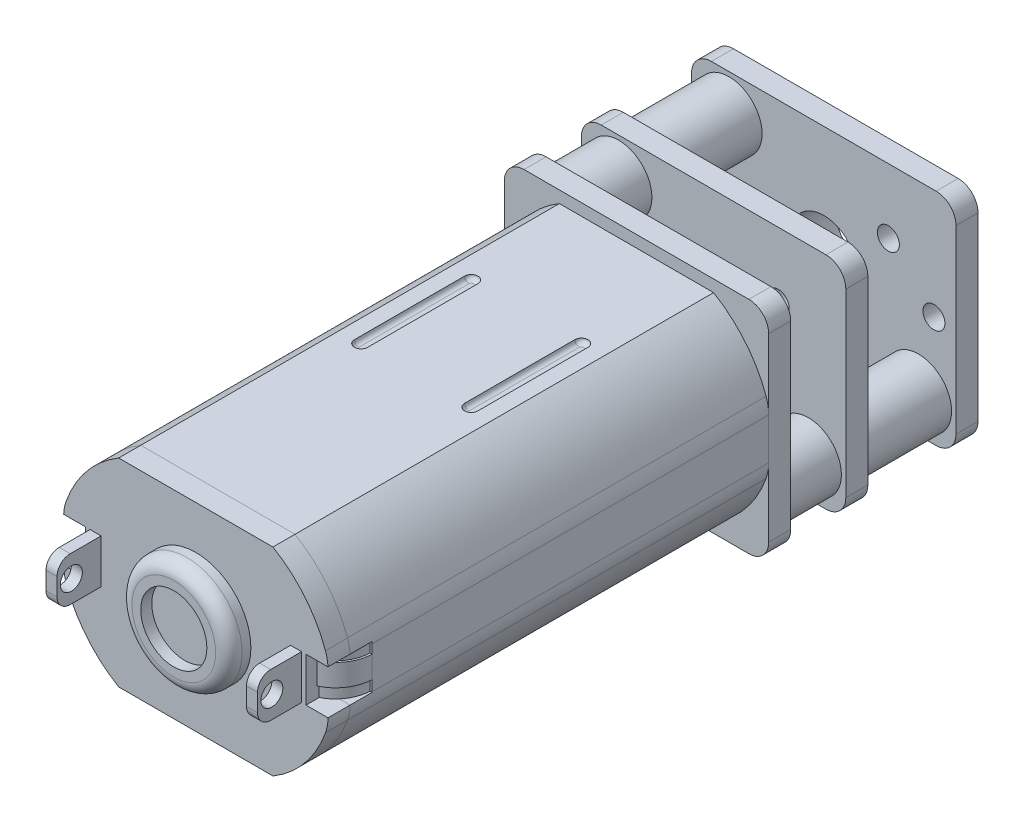
from build123d import *

# Parameters (mm, degrees)
BOSS_EXTRUDE1_DEPTH      = 20
FILLET2_R                = 2
BOSS_EXTRUDE2_DEPTH      = 1
SKETCH3_R                = 1
BOSS_EXTRUDE3_DEPTH      = 2
SKETCH4_R                = 1.5
BOSS_EXTRUDE4_DEPTH      = 2.5
BOSS_EXTRUDE5_DEPTH      = 1
SKETCH7_R                = 1.5
BOSS_EXTRUDE6_DEPTH      = 4
BOSS_EXTRUDE7_DEPTH      = 1
SKETCH10_R               = 2.5
BOSS_EXTRUDE8_DEPTH      = 1
SKETCH11_R               = 1.5
CUT_EXTRUDE1_DEPTH       = 0.5
FILLET3_R                = 0.6
SKETCH12_W               = 3.228098965
SKETCH12_H               = 2
CUT_EXTRUDE2_DEPTH       = 2
SPLIT1_SURFACE_1_BACK    = 35.267
SPLIT1_SURFACE_1_DEPTH   = 70.534
SPLIT1_SURFACE_2_BACK    = 35.267
SPLIT1_SURFACE_2_DEPTH   = 70.534
BOSS_EXTRUDE9_DEPTH      = 0.5
BOSS_EXTRUDE10_START     = -1
BOSS_EXTRUDE10_DEPTH     = 2
BOSS_EXTRUDE11_START     = -1
BOSS_EXTRUDE11_DEPTH     = 2
CUT_EXTRUDE3_DEPTH       = 0.2
FILLET4_R                = 0.2
FILLET4_OF_MIRROR2_R     = 0.2
SKETCH18_R               = 1.194438526
BOSS_EXTRUDE12_DEPTH     = 0.1
SKETCH19_R               = 0.5
CUT_EXTRUDE4_DEPTH       = 2
SKETCH20_R               = 1.5
CUT_EXTRUDE5_DEPTH       = 2
SKETCH21_R               = 2
SKETCH21_R_2             = 1.5
BOSS_EXTRUDE13_DEPTH     = 1
SKETCH23_W               = 0.5
SKETCH23_H               = 2
BOSS_EXTRUDE14_DEPTH     = 2
FILLET5_R                = 0.6
SKETCH24_R               = 0.5
CUT_EXTRUDE6_DEPTH       = 2
SKETCH25_R               = 0.5
CUT_EXTRUDE7_DEPTH       = 2
SKETCH29_R               = 0.5
CUT_EXTRUDE8_DEPTH       = 9
SKETCH30_R               = 0.75
CUT_EXTRUDE9_DEPTH       = 9.3
SKETCH31_R               = 0.5
CUT_EXTRUDE10_DEPTH      = 1
CHAMFER1_SIZE            = 0.2
CUT_EXTRUDE11_DEPTH      = 10
CUT_EXTRUDE11_DEPTH_BACK = 1
SKETCH32_R               = 0.5


# Read off the part's stored shape, not the designer's step: Boss-Extrude10, Boss-Extrude11
with BuildPart() as part:
    # Sketch1 → Boss-Extrude1 (new body)
    with BuildSketch(Plane.XY):
        with BuildLine():
            ThreePointArc((-3.5, -4.536728324), (-5.064185119, -3.153409185), (-6, -1.286728324))
            Line((-6, -1.286728324), (-6, 1.213271676))
            ThreePointArc((-6, 1.213271676), (-5.064185119, 3.079952537), (-3.5, 4.463271676))
            Line((-3.5, 4.463271676), (3.5, 4.463271676))
            ThreePointArc((3.5, 4.463271676), (5.064185119, 3.079952537), (6, 1.213271676))
            Line((6, 1.213271676), (6, -1.286728324))
            ThreePointArc((6, -1.286728324), (5.064185119, -3.153409185), (3.5, -4.536728324))
            Line((3.5, -4.536728324), (-3.5, -4.536728324))
        make_face()
    extrude(amount=BOSS_EXTRUDE1_DEPTH)

    # Fillet2
    fillet2_edges = [part.edges().sort_by_distance(p)[0] for p in [
        (-6, -1.286728324, 10),
        (-6, 1.213271676, 10),
        (6, 1.213271676, 10),
        (6, -1.286728324, 10),
    ]]
    fillet(fillet2_edges, radius=FILLET2_R)

    # Sketch10 → Boss-Extrude8 (add)
    with BuildSketch(Plane.XY.offset(20)):
        Circle(SKETCH10_R)
    extrude(amount=BOSS_EXTRUDE8_DEPTH)

    # Sketch11 → Cut-Extrude1 (cut)
    with BuildSketch(Plane.XY.offset(21)):
        Circle(SKETCH11_R)
    extrude(amount=-CUT_EXTRUDE1_DEPTH, mode=Mode.SUBTRACT)

    # Fillet3
    fillet3_edges = [part.edges().sort_by_distance(p)[0] for p in [
        (-2.5, 0, 21),
    ]]
    fillet(fillet3_edges, radius=FILLET3_R)

    # Sketch12 → Cut-Extrude2 (cut)
    with BuildSketch(Plane.XY.offset(20)):
        with Locations((6.614049483, 0)):
            Rectangle(SKETCH12_W, SKETCH12_H)
        with Locations((-6.614049483, 0)):
            Rectangle(SKETCH12_W, SKETCH12_H)
    extrude(amount=-CUT_EXTRUDE2_DEPTH, mode=Mode.SUBTRACT)


with BuildPart() as body_2:
    # Sketch2 → Boss-Extrude2 (new body)
    with BuildSketch(Plane(origin=(0, 0, 0), x_dir=(-1, 0, 0), z_dir=(0, 0, -1))):
        with BuildLine():
            Line((-5.1, -5), (5.1, -5))
            ThreePointArc((5.1, -5), (5.736396103, -4.736396103), (6, -4.1))
            Line((6, -4.1), (6, 4.1))
            ThreePointArc((6, 4.1), (5.736396103, 4.736396103), (5.1, 5))
            Line((5.1, 5), (-5.1, 5))
            ThreePointArc((-5.1, 5), (-5.736396103, 4.736396103), (-6, 4.1))
            Line((-6, 4.1), (-6, -4.1))
            ThreePointArc((-6, -4.1), (-5.736396103, -4.736396103), (-5.1, -5))
        make_face()
    extrude(amount=BOSS_EXTRUDE2_DEPTH)

    # Sketch3 → Boss-Extrude3 (add)
    with BuildSketch(Plane(origin=(0, 0, -1), x_dir=(-1, 0, 0), z_dir=(0, 0, -1))):
        with Locations(Location((0, 0, 0), (0, 0, 180))):
            Circle(SKETCH3_R)
    extrude(amount=BOSS_EXTRUDE3_DEPTH)

    # Sketch4 → Boss-Extrude4 (add)
    with BuildSketch(Plane(origin=(0, 0, -1), x_dir=(-1, 0, 0), z_dir=(0, 0, -1))):
        with Locations(Location((4.3, 3.3, 0), (0, 0, 180))):
            Circle(SKETCH4_R)
        with Locations(Location((-4.3, -3.3, 0), (0, 0, 180))):
            Circle(SKETCH4_R)
    extrude(amount=BOSS_EXTRUDE4_DEPTH)

    # Sketch5 → Boss-Extrude5 (add)
    with BuildSketch(Plane(origin=(0, 0, -3.5), x_dir=(-1, 0, 0), z_dir=(0, 0, -1))):
        with BuildLine():
            Line((5.1, 5), (-5.1, 5))
            ThreePointArc((-5.1, 5), (-5.736396103, 4.736396103), (-6, 4.1))
            Line((-6, 4.1), (-6, 1.107908183))
            Line((-6, 1.107908183), (-6, -4.1))
            ThreePointArc((-6, -4.1), (-5.736396103, -4.736396103), (-5.1, -5))
            Line((-5.1, -5), (1.1, -5))
            ThreePointArc((1.1, -5), (1.736396103, -4.736396103), (2, -4.1))
            Line((2, -4.1), (2, 0.207908183))
            ThreePointArc((2, 0.207908183), (2.263603897, 0.844304286), (2.9, 1.107908183))
            Line((2.9, 1.107908183), (5.1, 1.107908183))
            ThreePointArc((5.1, 1.107908183), (5.736396103, 1.37151208), (6, 2.007908183))
            Line((6, 2.007908183), (6, 4.1))
            ThreePointArc((6, 4.1), (5.736396103, 4.736396103), (5.1, 5))
        make_face()
    extrude(amount=BOSS_EXTRUDE5_DEPTH)

    # Sketch7 → Boss-Extrude6 (add)
    with BuildSketch(Plane(origin=(0, 0, -4.5), x_dir=(-1, 0, 0), z_dir=(0, 0, -1))):
        with Locations(Location((-4.3, -3.3, 0), (0, 0, 180))):
            Circle(SKETCH7_R)
        with Locations(Location((4.3, 3.3, 0), (0, 0, 180))):
            Circle(SKETCH7_R)
    extrude(amount=BOSS_EXTRUDE6_DEPTH)

    # Sketch8 → Boss-Extrude7 (add)
    with BuildSketch(Plane(origin=(0, 0, -8.5), x_dir=(-1, 0, 0), z_dir=(0, 0, -1))):
        with BuildLine():
            Line((5.1, 5), (-5.1, 5))
            ThreePointArc((-5.1, 5), (-5.736396103, 4.736396103), (-6, 4.1))
            Line((-6, 4.1), (-6, -4.1))
            ThreePointArc((-6, -4.1), (-5.736396103, -4.736396103), (-5.1, -5))
            Line((-5.1, -5), (5.1, -5))
            ThreePointArc((5.1, -5), (5.736396103, -4.736396103), (6, -4.1))
            Line((6, -4.1), (6, 4.1))
            ThreePointArc((6, 4.1), (5.736396103, 4.736396103), (5.1, 5))
        make_face()
    extrude(amount=BOSS_EXTRUDE7_DEPTH)

    # Sketch18 → Boss-Extrude12 (add)
    with BuildSketch(Plane(origin=(0, 0, -3), x_dir=(-1, 0, 0), z_dir=(0, 0, -1))):
        Circle(SKETCH18_R)
    extrude(amount=-BOSS_EXTRUDE12_DEPTH)

    # Sketch19 → Cut-Extrude4 (cut)
    with BuildSketch(Plane(origin=(0, 0, -9.5), x_dir=(-1, 0, 0), z_dir=(0, 0, -1))):
        with Locations((-5, 0)):
            Circle(SKETCH19_R)
        with Locations((5, 0)):
            Circle(SKETCH19_R)
    extrude(amount=-CUT_EXTRUDE4_DEPTH, mode=Mode.SUBTRACT)

    # Sketch20 → Cut-Extrude5 (cut)
    with BuildSketch(Plane(origin=(0, 0, -9.5), x_dir=(-1, 0, 0), z_dir=(0, 0, -1))):
        with Locations(Location((0, 0, 0), (0, 0, 180))):
            Circle(SKETCH20_R)
    extrude(amount=-CUT_EXTRUDE5_DEPTH, mode=Mode.SUBTRACT)

    # Sketch21 → Boss-Extrude13 (add)
    with BuildSketch(Plane(origin=(0, 0, -9.5), x_dir=(-1, 0, 0), z_dir=(0, 0, -1))):
        with Locations(Location((0, 0, 0), (0, 0, 180))):
            Circle(SKETCH21_R)
        with Locations(Location((0, 0, 0), (0, 0, 180))):
            Circle(SKETCH21_R_2, mode=Mode.SUBTRACT)
    extrude(amount=BOSS_EXTRUDE13_DEPTH)

    # Sketch29 → Cut-Extrude8 (cut)
    with BuildSketch(Plane(origin=(0, 0, -9.5), x_dir=(-1, 0, 0), z_dir=(0, 0, -1))):
        with Locations((3.22, -1.25)):
            Circle(SKETCH29_R)
    extrude(amount=-CUT_EXTRUDE8_DEPTH, mode=Mode.SUBTRACT)

    # Sketch30 → Cut-Extrude9 (cut)
    with BuildSketch(Plane(origin=(0, 0, -9.5), x_dir=(-1, 0, 0), z_dir=(0, 0, -1))):
        with Locations((-4.3, -3.3)):
            Circle(SKETCH30_R)
        with Locations((4.3, 3.3)):
            Circle(SKETCH30_R)
    extrude(amount=-CUT_EXTRUDE9_DEPTH, mode=Mode.SUBTRACT)

    # Sketch31 → Cut-Extrude10 (cut)
    with BuildSketch(Plane(origin=(0, 0, -4.5), x_dir=(-1, 0, 0), z_dir=(0, 0, -1))):
        Circle(SKETCH31_R)
    extrude(amount=-CUT_EXTRUDE10_DEPTH, mode=Mode.SUBTRACT)

    # Chamfer1
    chamfer1_edges = [body_2.edges().sort_by_distance(p)[0] for p in [
        (5.05, -3.3, -9.5),
        (-3.55, 3.3, -9.5),
    ]]
    chamfer(chamfer1_edges, length=CHAMFER1_SIZE)

    # Sketch32 → Cut-Extrude11 (cut, two sides: drawn at the far end of the back side and taken through both)
    with BuildSketch(Plane(origin=(0, 0, -4.5), x_dir=(-1, 0, 0), z_dir=(0, 0, -1)).offset(-CUT_EXTRUDE11_DEPTH_BACK)):
        with Locations(Location((-2.93, 2.06, 0), (0, 0, 180))):
            Circle(SKETCH32_R)
    extrude(amount=CUT_EXTRUDE11_DEPTH + CUT_EXTRUDE11_DEPTH_BACK, mode=Mode.SUBTRACT)


with BuildPart() as body_3:
    # Split1: the piece behind the surface
    add(part.part)
    # Split1 surface: a surface, the sketch's curves swept straight by 70.534 mm
    with BuildLine(Plane(origin=(0, 0, 0), x_dir=(0, 0, -1), z_dir=(1, 0, 0)).offset(-SPLIT1_SURFACE_1_BACK), mode=Mode.PRIVATE) as split1_surface_1_path:
        Line((-19, 9.247780944), (-19, -9.247780944))
    split1_surface_1 = Shell.extrude(split1_surface_1_path.wire(), (1 * SPLIT1_SURFACE_1_DEPTH, 0 * SPLIT1_SURFACE_1_DEPTH, 0 * SPLIT1_SURFACE_1_DEPTH))
    split(bisect_by=split1_surface_1, keep=Keep.BOTTOM)

    # Boss-Extrude10 outline → Boss-Extrude10 (add)
    with BuildSketch(Plane(origin=(0, 0, 0), x_dir=(1, 0, 0), z_dir=(0, 1, 0)).offset(BOSS_EXTRUDE10_START)):
        with BuildLine():
            ThreePointArc((-5.909884441, -18), (-5.645311676, -18.823724433), (-5, -19.4))
            Line((-5, -19.4), (-5, -18))
            Line((-5, -18), (-5.909884441, -18))
        make_face()
    extrude(amount=BOSS_EXTRUDE10_DEPTH)

    # Boss-Extrude11 outline → Boss-Extrude11 (add)
    with BuildSketch(Plane(origin=(0, 0, 0), x_dir=(1, 0, 0), z_dir=(0, 1, 0)).offset(BOSS_EXTRUDE11_START)):
        with BuildLine():
            Line((5.909884441, -18), (5, -18))
            Line((5, -18), (5, -19.4))
            ThreePointArc((5, -19.4), (5.645311676, -18.823724433), (5.909884441, -18))
        make_face()
    extrude(amount=BOSS_EXTRUDE11_DEPTH)

    # Sketch23 → Boss-Extrude14 (add)
    with BuildSketch(Plane.XY.offset(20)):
        with Locations((-4.55, 0)):
            Rectangle(SKETCH23_W, SKETCH23_H)
        with Locations((4.55, 0)):
            Rectangle(SKETCH23_W, SKETCH23_H)
    extrude(amount=BOSS_EXTRUDE14_DEPTH)

    # Fillet5
    fillet5_edges = [body_3.edges().sort_by_distance(p)[0] for p in [
        (-4.55, 1, 22),
        (-4.55, -1, 22),
        (4.55, 1, 22),
        (4.55, -1, 22),
    ]]
    fillet(fillet5_edges, radius=FILLET5_R)

    # Sketch24 → Cut-Extrude6 (cut)
    with BuildSketch(Plane.ZY.offset(4.8)):
        with Locations((21.35, 0)):
            Circle(SKETCH24_R)
    extrude(amount=-CUT_EXTRUDE6_DEPTH, mode=Mode.SUBTRACT)

    # Sketch25 → Cut-Extrude7 (cut)
    with BuildSketch(Plane(origin=(4.8, 0, 0), x_dir=(0, 0, -1), z_dir=(1, 0, 0))):
        with Locations(Location((-21.35, 0, 0), (0, 0, 180))):
            Circle(SKETCH25_R)
    extrude(amount=-CUT_EXTRUDE7_DEPTH, mode=Mode.SUBTRACT)


with BuildPart() as part_1:
    add(part.part)

    # Split1: split by a surface, the side it looks to stays
    # Split1 surface: a surface, the sketch's curves swept straight by 70.534 mm
    with BuildLine(Plane(origin=(0, 0, 0), x_dir=(0, 0, -1), z_dir=(1, 0, 0)).offset(-SPLIT1_SURFACE_2_BACK), mode=Mode.PRIVATE) as split1_surface_2_path:
        Line((-19, 9.247780944), (-19, -9.247780944))
    split1_surface_2 = Shell.extrude(split1_surface_2_path.wire(), (1 * SPLIT1_SURFACE_2_DEPTH, 0 * SPLIT1_SURFACE_2_DEPTH, 0 * SPLIT1_SURFACE_2_DEPTH))
    split(bisect_by=split1_surface_2, keep=Keep.TOP)

    # Sketch14 → Boss-Extrude9 (add, symmetric)
    with BuildSketch(Plane(origin=(0, 0, 0), x_dir=(1, 0, 0), z_dir=(0, 1, 0))):
        with BuildLine():
            Line((6, -18), (5.909884441, -18))
            ThreePointArc((5.909884441, -18), (5.645311676, -18.823724433), (5, -19.4))
            Line((5, -19.4), (5, -19.5))
            ThreePointArc((5, -19.5), (5.709628603, -18.889752402), (6, -18))
        make_face()
        with BuildLine():
            ThreePointArc((-5, -19.4), (-5.645311676, -18.823724433), (-5.909884441, -18))
            Line((-5.909884441, -18), (-6, -18))
            ThreePointArc((-6, -18), (-5.709628603, -18.889752402), (-5, -19.5))
            Line((-5, -19.5), (-5, -19.4))
        make_face()
    extrude(amount=BOSS_EXTRUDE9_DEPTH, both=True)

    # Sketch17 → Cut-Extrude3 (cut)
    with BuildSketch(Plane(origin=(0, 4.463271676, 0), x_dir=(1, 0, 0), z_dir=(0, 1, 0))):
        with BuildLine():
            Line((2.8, -5), (2.8, -10))
            ThreePointArc((2.8, -10), (2.5, -10.3), (2.2, -10))
            Line((2.2, -10), (2.2, -5))
            ThreePointArc((2.2, -5), (2.5, -4.7), (2.8, -5))
        make_face()
        with BuildLine():
            Line((-2.2, -5), (-2.2, -10))
            ThreePointArc((-2.2, -10), (-2.5, -10.3), (-2.8, -10))
            Line((-2.8, -10), (-2.8, -5))
            ThreePointArc((-2.8, -5), (-2.5, -4.7), (-2.2, -5))
        make_face()
    cut_extrude3 = extrude(amount=-CUT_EXTRUDE3_DEPTH, mode=Mode.SUBTRACT)

    # Fillet4
    fillet4_edges = [part_1.edges().sort_by_distance(p)[0] for p in [
        (2.8, 4.263271676, 7.5),
        (2.5, 4.263271676, 10.3),
        (2.2, 4.263271676, 7.5),
        (2.5, 4.263271676, 4.7),
        (-2.2, 4.263271676, 7.5),
        (-2.5, 4.263271676, 10.3),
        (-2.8, 4.263271676, 7.5),
        (-2.5, 4.263271676, 4.7),
    ]]
    fillet(fillet4_edges, radius=FILLET4_R - 0.0001)  # a hair under: the kernel refuses the full size

    # Mirror2: Cut-Extrude3 across plane
    add(cut_extrude3.mirror(Plane.ZX.offset(-0.036728324)), mode=Mode.SUBTRACT)

    # Fillet4 of Mirror2
    fillet4_of_mirror2_edges = [part_1.edges().sort_by_distance(p)[0] for p in [
        (2.8, -4.336728324, 7.5),
        (2.5, -4.336728324, 10.3),
        (2.2, -4.336728324, 7.5),
        (2.5, -4.336728324, 4.7),
        (-2.2, -4.336728324, 7.5),
        (-2.5, -4.336728324, 10.3),
        (-2.8, -4.336728324, 7.5),
        (-2.5, -4.336728324, 4.7),
    ]]
    fillet(fillet4_of_mirror2_edges, radius=FILLET4_OF_MIRROR2_R - 0.0001)  # a hair under: the kernel refuses the full size


solid = Compound([body_2.part, body_3.part, part_1.part])
